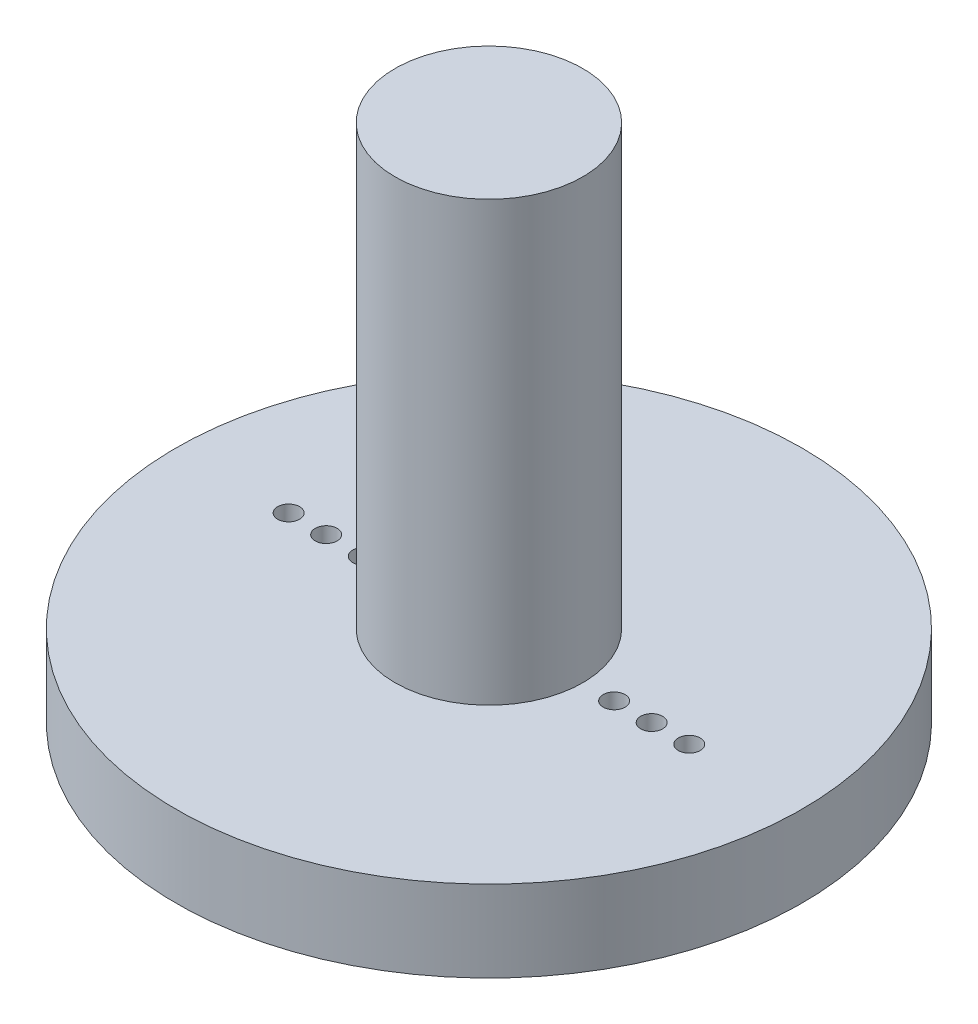
from build123d import *

# Parameters (mm, degrees)
SKETCH1_R             = 25
BOSS_EXTRUDE1_DEPTH   = 6.5
HORN_HOLE_DEPTH       = 2
SCREW_HOLES_REACH     = 37.641
SKETCH9_R             = 0.875
SKETCH11_R            = 7.5
BOSS_EXTRUDE2_DEPTH   = 35
SCREW_HEAD_HOLE_ANGLE = 180


with BuildPart() as part:
    # Sketch1 → Boss-Extrude1 (new body)
    with BuildSketch(Plane(origin=(0, 0, 0), x_dir=(1, 0, 0), z_dir=(0, 1, 0))):
        Circle(SKETCH1_R)
    extrude(amount=BOSS_EXTRUDE1_DEPTH)

    # Sketch8 → Horn Hole (cut)
    with BuildSketch(Plane.XZ):
        with BuildLine():
            ThreePointArc((2.867832451, 6.276606431), (5.55485913, 5.311303559), (8.103473198, 4.024257195))
            ThreePointArc((8.103473198, 4.024257195), (12.790122891, 3.37163327), (17.445502266, 2.524257195))
            ThreePointArc((17.445502266, 2.524257195), (19.894779582, 1.820498395), (21, -0.475742805))
            ThreePointArc((21, -0.475742805), (19.60737188, -2.167378066), (17.445502266, -2.524257195))
            ThreePointArc((17.445502266, -2.524257195), (12.790122891, -3.37163327), (8.103473198, -4.024257195))
            ThreePointArc((8.103473198, -4.024257195), (5.55485913, -5.311303559), (2.867832451, -6.276606431))
            ThreePointArc((2.867832451, -6.276606431), (0, -6.900742805), (-2.867832451, -6.276606431))
            ThreePointArc((-2.867832451, -6.276606431), (-5.55485913, -5.311303559), (-8.103473198, -4.024257195))
            ThreePointArc((-8.103473198, -4.024257195), (-12.780142502, -3.846309279), (-17.445502266, -3.475742805))
            ThreePointArc((-17.445502266, -3.475742805), (-19.894779582, -2.771984005), (-21, -0.475742805))
            ThreePointArc((-21, -0.475742805), (-19.894779582, 1.820498395), (-17.445502266, 2.524257195))
            ThreePointArc((-17.445502266, 2.524257195), (-12.790122891, 3.37163327), (-8.103473198, 4.024257195))
            ThreePointArc((-8.103473198, 4.024257195), (-5.55485913, 5.311303559), (-2.867832451, 6.276606431))
            ThreePointArc((-2.867832451, 6.276606431), (0, 6.900742805), (2.867832451, 6.276606431))
        make_face()
    extrude(amount=-HORN_HOLE_DEPTH, mode=Mode.SUBTRACT)

    # Sketch9 → Screw Holes (cut, up to next)
    with BuildSketch(Plane.XZ.offset(-2), mode=Mode.PRIVATE) as screw_holes_sk1:
        with Locations((10, 0)):
            Circle(SKETCH9_R)
    screw_holes_tool1 = extrude(screw_holes_sk1.sketch, amount=-SCREW_HOLES_REACH, mode=Mode.PRIVATE) & part.part
    # Sketch9 → Screw Holes (cut, up to next)
    with BuildSketch(Plane.XZ.offset(-2), mode=Mode.PRIVATE) as screw_holes_sk2:
        with Locations((13, 0)):
            Circle(SKETCH9_R)
    screw_holes_tool2 = extrude(screw_holes_sk2.sketch, amount=-SCREW_HOLES_REACH, mode=Mode.PRIVATE) & part.part
    # Sketch9 → Screw Holes (cut, up to next)
    with BuildSketch(Plane.XZ.offset(-2), mode=Mode.PRIVATE) as screw_holes_sk3:
        with Locations((16, 0)):
            Circle(SKETCH9_R)
    screw_holes_tool3 = extrude(screw_holes_sk3.sketch, amount=-SCREW_HOLES_REACH, mode=Mode.PRIVATE) & part.part
    # Sketch9 → Screw Holes (cut, up to next)
    with BuildSketch(Plane.XZ.offset(-2), mode=Mode.PRIVATE) as screw_holes_sk4:
        with Locations((-10, 0)):
            Circle(SKETCH9_R)
    screw_holes_tool4 = extrude(screw_holes_sk4.sketch, amount=-SCREW_HOLES_REACH, mode=Mode.PRIVATE) & part.part
    # Sketch9 → Screw Holes (cut, up to next)
    with BuildSketch(Plane.XZ.offset(-2), mode=Mode.PRIVATE) as screw_holes_sk5:
        with Locations((-13, 0)):
            Circle(SKETCH9_R)
    screw_holes_tool5 = extrude(screw_holes_sk5.sketch, amount=-SCREW_HOLES_REACH, mode=Mode.PRIVATE) & part.part
    # Sketch9 → Screw Holes (cut, up to next)
    with BuildSketch(Plane.XZ.offset(-2), mode=Mode.PRIVATE) as screw_holes_sk6:
        with Locations((-16, 0)):
            Circle(SKETCH9_R)
    screw_holes_tool6 = extrude(screw_holes_sk6.sketch, amount=-SCREW_HOLES_REACH, mode=Mode.PRIVATE) & part.part
    add(screw_holes_tool1.solids().sort_by_distance((10, 2, 0))[0], mode=Mode.SUBTRACT)
    add(screw_holes_tool2.solids().sort_by_distance((13, 2, 0))[0], mode=Mode.SUBTRACT)
    add(screw_holes_tool3.solids().sort_by_distance((16, 2, 0))[0], mode=Mode.SUBTRACT)
    add(screw_holes_tool4.solids().sort_by_distance((-10, 2, 0))[0], mode=Mode.SUBTRACT)
    add(screw_holes_tool5.solids().sort_by_distance((-13, 2, 0))[0], mode=Mode.SUBTRACT)
    add(screw_holes_tool6.solids().sort_by_distance((-16, 2, 0))[0], mode=Mode.SUBTRACT)

    # Sketch11 → Boss-Extrude2 (add)
    with BuildSketch(Plane(origin=(0, 6.5, 0), x_dir=(1, 0, 0), z_dir=(0, 1, 0))):
        Circle(SKETCH11_R)
    extrude(amount=BOSS_EXTRUDE2_DEPTH)

    # Sketch13 → Screw Head Hole (revolve, cut)
    with BuildSketch(Plane.XZ.offset(-2)):
        with BuildLine():
            Line((3.4, 0), (-3.4, 0))
            ThreePointArc((-3.4, 0), (0, -3.4), (3.4, 0))
        make_face()
    revolve(axis=Axis((3.4, 2, 0), (1, 0, 0)), revolution_arc=SCREW_HEAD_HOLE_ANGLE, mode=Mode.SUBTRACT)


solid = part.part
